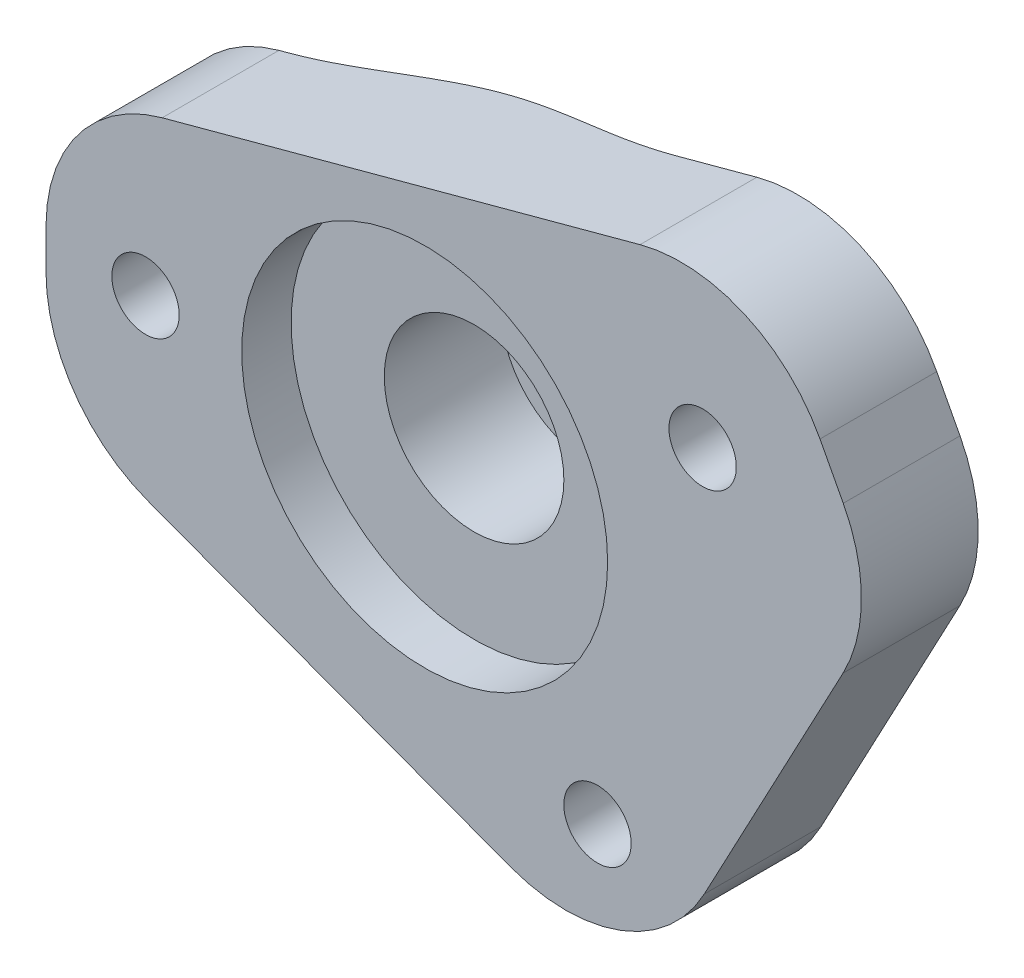
from build123d import *

# Parameters (mm, degrees)
SKETCH1_R           = 8
SKETCH1_R_2         = 1.5
BOSS_EXTRUDE1_DEPTH = 2.2
BOSS_EXTRUDE2_START = 2.2
SKETCH1_3_R         = 8
SKETCH1_3_R_2       = 4
BOSS_EXTRUDE2_DEPTH = 3
FILLET1_R           = 7
CUT_EXTRUDE2_START  = -5.2
SKETCH2_R           = 8.05
SKETCH2_R_2         = 7
CUT_EXTRUDE2_DEPTH  = 2.2
SKETCH2_4_R         = 7
SKETCH2_4_R_2       = 4
BOSS_EXTRUDE3_DEPTH = 2.2
BOSS_EXTRUDE4_START = 2.2
SKETCH2_5_R         = 7
SKETCH2_5_R_2       = 4
BOSS_EXTRUDE4_DEPTH = 2
FILLET2_START       = -35.2
FILLET2_2_DEPTH     = 4.2
SKETCH3_R           = 8.15
SKETCH3_R_2         = 8.05
CUT_EXTRUDE3_DEPTH  = 2.2


with BuildPart() as part:
    # Sketch1 → Boss-Extrude1 (new body)
    # profile 1 of 4: a face of its own
    with BuildSketch(Plane(origin=(0, 0, -25.8), x_dir=(-1, 0, 0), z_dir=(0, 0, -1))):
        Polygon((-133.135100578, -5.831793049), (-133.135100578, 6.168206951), (-159.569076944, 16.05794409), (-170.376148703, -4.244942404), (-164.993668486, -14.43595779), align=None)
        with Locations((-150, 0)):
            Circle(SKETCH1_R, mode=Mode.SUBTRACT)
        Polygon((-165.667996862, -6.414349097), (-164.131074119, -9.324309317), (-160.842513273, -9.448275288), (-159.09087517, -6.662281039), (-160.627797913, -3.752320819), (-163.916358759, -3.628354848), align=None, mode=Mode.SUBTRACT)
        Polygon((-140.417550289, 1.645448267), (-140.417550289, -1.645448267), (-137.567550289, -3.290896534), (-134.717550289, -1.645448267), (-134.717550289, 1.645448267), (-137.567550289, 3.290896534), align=None, mode=Mode.SUBTRACT)
        Polygon((-160.873796009, 9.464930151), (-158.542174952, 7.142529831), (-155.365106749, 8.000572737), (-154.519659602, 11.181015965), (-156.851280658, 13.503416285), (-160.028348862, 12.645373378), align=None, mode=Mode.SUBTRACT)
    # profile 2 of 4: a face of its own
    with BuildSketch(Plane(origin=(0, 0, -25.8), x_dir=(-1, 0, 0), z_dir=(0, 0, -1))):
        Polygon((-163.916358759, -3.628354848), (-165.667996862, -6.414349097), (-164.131074119, -9.324309317), (-160.842513273, -9.448275288), (-159.09087517, -6.662281039), (-160.627797913, -3.752320819), align=None)
        with Locations((-162.379436016, -6.538315068)):
            Circle(SKETCH1_R_2, mode=Mode.SUBTRACT)
    # profile 3 of 4: a face of its own
    with BuildSketch(Plane(origin=(0, 0, -25.8), x_dir=(-1, 0, 0), z_dir=(0, 0, -1))):
        Polygon((-160.028348862, 12.645373378), (-160.873796009, 9.464930151), (-158.542174952, 7.142529831), (-155.365106749, 8.000572737), (-154.519659602, 11.181015965), (-156.851280658, 13.503416285), align=None)
        with Locations((-157.696727805, 10.322973058)):
            Circle(SKETCH1_R_2, mode=Mode.SUBTRACT)
    # profile 4 of 4: a face of its own
    with BuildSketch(Plane(origin=(0, 0, -25.8), x_dir=(-1, 0, 0), z_dir=(0, 0, -1))):
        Polygon((-137.567550289, 3.290896534), (-140.417550289, 1.645448267), (-140.417550289, -1.645448267), (-137.567550289, -3.290896534), (-134.717550289, -1.645448267), (-134.717550289, 1.645448267), align=None)
        with Locations((-137.567550289, 0)):
            Circle(SKETCH1_R_2, mode=Mode.SUBTRACT)
    extrude(amount=BOSS_EXTRUDE1_DEPTH)

    # Sketch1<3> → Boss-Extrude2 (add)
    # profile 1 of 2: a face of its own
    with BuildSketch(Plane(origin=(0, 0, -25.8), x_dir=(-1, 0, 0), z_dir=(0, 0, -1)).offset(BOSS_EXTRUDE2_START)):
        Polygon((-133.135100578, -5.831793049), (-133.135100578, 6.168206951), (-159.569076944, 16.05794409), (-170.376148703, -4.244942404), (-164.993668486, -14.43595779), align=None)
        with Locations((-150, 0)):
            Circle(SKETCH1_3_R, mode=Mode.SUBTRACT)
        Polygon((-165.667996862, -6.414349097), (-164.131074119, -9.324309317), (-160.842513273, -9.448275288), (-159.09087517, -6.662281039), (-160.627797913, -3.752320819), (-163.916358759, -3.628354848), align=None, mode=Mode.SUBTRACT)
        Polygon((-140.417550289, 1.645448267), (-140.417550289, -1.645448267), (-137.567550289, -3.290896534), (-134.717550289, -1.645448267), (-134.717550289, 1.645448267), (-137.567550289, 3.290896534), align=None, mode=Mode.SUBTRACT)
        Polygon((-160.873796009, 9.464930151), (-158.542174952, 7.142529831), (-155.365106749, 8.000572737), (-154.519659602, 11.181015965), (-156.851280658, 13.503416285), (-160.028348862, 12.645373378), align=None, mode=Mode.SUBTRACT)
    # profile 2 of 2: a face of its own
    with BuildSketch(Plane(origin=(0, 0, -25.8), x_dir=(-1, 0, 0), z_dir=(0, 0, -1)).offset(BOSS_EXTRUDE2_START)):
        with Locations((-150, 0)):
            Circle(SKETCH1_3_R)
        with Locations((-150, 0)):
            Circle(SKETCH1_3_R_2, mode=Mode.SUBTRACT)
    extrude(amount=BOSS_EXTRUDE2_DEPTH)

    # Fillet1
    fillet1_edges = [part.edges().sort_by_distance(p)[0] for p in [
        (133.135100578, -5.831793049, -28.4),
        (164.993668486, -14.43595779, -28.4),
        (170.376148703, -4.244942404, -28.4),
        (159.569076944, 16.05794409, -28.4),
        (133.135100578, 6.168206951, -28.4),
    ]]
    fillet(fillet1_edges, radius=FILLET1_R)

    # Sketch2 → Cut-Extrude2 (cut)
    with BuildSketch(Plane(origin=(0, 0, -31), x_dir=(-1, 0, 0), z_dir=(0, 0, -1)).offset(CUT_EXTRUDE2_START)):
        with Locations(Location((-150, 0, 0), (0, 0, 180))):
            Circle(SKETCH2_R)
        with Locations((-150, 0)):
            Circle(SKETCH2_R_2, mode=Mode.SUBTRACT)
    extrude(amount=CUT_EXTRUDE2_DEPTH, mode=Mode.SUBTRACT)

    # Sketch2<4> → Boss-Extrude3 (add)
    with BuildSketch(Plane(origin=(0, 0, -31), x_dir=(-1, 0, 0), z_dir=(0, 0, -1))):
        with Locations(Location((-150, 0, 0), (0, 0, 180))):
            Circle(SKETCH2_4_R)
        with Locations(Location((-150, 0, 0), (0, 0, 180))):
            Circle(SKETCH2_4_R_2, mode=Mode.SUBTRACT)
    extrude(amount=BOSS_EXTRUDE3_DEPTH)

    # Sketch2<5> → Boss-Extrude4 (add)
    # profile 1 of 2: a face of its own
    with BuildSketch(Plane(origin=(0, 0, -31), x_dir=(-1, 0, 0), z_dir=(0, 0, -1)).offset(BOSS_EXTRUDE4_START)):
        with Locations(Location((-150, 0, 0), (0, 0, 180))):
            Circle(SKETCH2_5_R)
        with Locations(Location((-150, 0, 0), (0, 0, 180))):
            Circle(SKETCH2_5_R_2, mode=Mode.SUBTRACT)
    # profile 2 of 2: a face of its own
    with BuildSketch(Plane(origin=(0, 0, -31), x_dir=(-1, 0, 0), z_dir=(0, 0, -1)).offset(BOSS_EXTRUDE4_START)):
        with Locations(Location((-150, 0, 0), (0, 0, 180))):
            Circle(SKETCH2_5_R_2)
    extrude(amount=BOSS_EXTRUDE4_DEPTH)

    # Fillet2: read off the stored shape, not the designer's step
    # Fillet2 outline → Fillet2 (revolve)
    with BuildSketch(Plane(origin=(150, 0, 0), x_dir=(1, 0, 0), z_dir=(0, -1, 0))):
        with BuildLine():
            ThreePointArc((7, -35.2), (9.58154807, -32.143379814), (13.415605973, -31))
            Line((13.415605973, -31), (7, -31))
            Line((7, -31), (7, -35.2))
        make_face()
    revolve(axis=Axis((150, 0, 0), (0, 0, 1)))

    # Fillet2 2 outline → Fillet2 2 (cut)
    with BuildSketch(Plane.XY.offset(FILLET2_START)):
        with BuildLine():
            Line((140.417550289, 1.645448267), (137.567550289, 3.290896534))
            Line((137.567550289, 3.290896534), (136.903212084, 2.907340693))
            ThreePointArc((136.903212084, 2.907340693), (136.584394027, 0), (136.903212084, -2.907340693))
            Line((136.903212084, -2.907340693), (137.567550289, -3.290896534))
            Line((137.567550289, -3.290896534), (140.417550289, -1.645448267))
            Line((140.417550289, -1.645448267), (140.417550289, 1.645448267))
        make_face()
        with BuildLine():
            Line((159.09087517, -6.662281039), (160.303741962, -8.59135526))
            ThreePointArc((160.303741962, -8.59135526), (161.862688268, -6.265389906), (162.904858589, -3.666484475))
            Line((162.904858589, -3.666484475), (160.627797913, -3.752320819))
            Line((160.627797913, -3.752320819), (159.09087517, -6.662281039))
        make_face()
        with BuildLine():
            Line((155.989734556, -12.004231069), (138.781383409, -7.356706152))
            ThreePointArc((138.781383409, -7.356706152), (146.50211867, -12.951575573), (155.989734556, -12.004231069))
        make_face()
        with BuildLine():
            ThreePointArc((152.074956497, 13.254170633), (145.29905415, 12.565014594), (139.734777095, 8.637342318))
            Line((139.734777095, 8.637342318), (152.074956497, 13.254170633))
        make_face()
        with BuildLine():
            Line((155.365106749, 8.000572737), (158.542174952, 7.142529831))
            Line((158.542174952, 7.142529831), (160.163207231, 8.7571515))
            ThreePointArc((160.163207231, 8.7571515), (158.046418581, 10.7346929), (155.554467123, 12.211731188))
            Line((155.554467123, 12.211731188), (154.519659602, 11.181015965))
            Line((154.519659602, 11.181015965), (155.365106749, 8.000572737))
        make_face()
    extrude(amount=FILLET2_2_DEPTH, mode=Mode.SUBTRACT)

    # Sketch3 → Cut-Extrude3 (cut)
    with BuildSketch(Plane.XY.offset(-25.8)):
        with Locations((150, 0)):
            Circle(SKETCH3_R)
        with Locations((150, 0)):
            Circle(SKETCH3_R_2, mode=Mode.SUBTRACT)
    extrude(amount=-CUT_EXTRUDE3_DEPTH, mode=Mode.SUBTRACT)


with BuildPart() as body_2:
    # Mirror3: mirrored copy
    add(part.part.mirror(Plane.ZX))


solid = body_2.part
